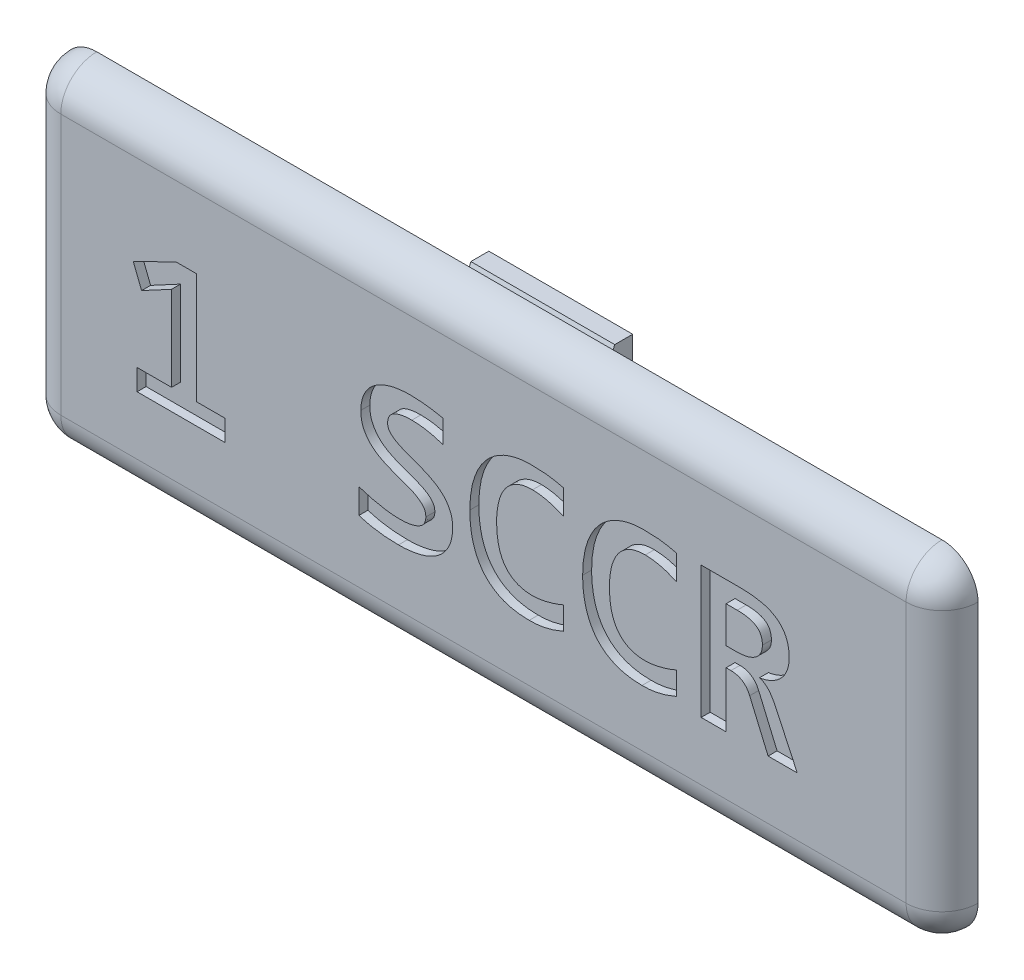
from build123d import *

# Parameters (mm, degrees)
BOSS_EXTRUDE1_DEPTH = 2
SKETCH3_W           = 47.5
SKETCH3_H           = 15
BOSS_EXTRUDE2_DEPTH = 1
SKETCH4_W           = 9.5
SKETCH4_H           = 5
CUT_EXTRUDE1_DEPTH  = 1
SKETCH5_W           = 8
SKETCH5_H           = 8.5
CUT_EXTRUDE2_DEPTH  = 1
SKETCH6_W           = 4
SKETCH6_H           = 1.75
BOSS_EXTRUDE3_DEPTH = 1.75
BOSS_EXTRUDE4_DEPTH = 4
FILLET1_R           = 2
CUT_EXTRUDE3_DEPTH  = 0.5


with BuildPart() as part:
    # Sketch1 → Boss-Extrude1 (new body)
    with BuildSketch(Plane.XY):
        with BuildLine():
            Line((25.5, -7.25), (25.5, 7.25))
            ThreePointArc((25.5, 7.25), (24.914213562, 8.664213562), (23.5, 9.25))
            Line((23.5, 9.25), (-23.5, 9.25))
            ThreePointArc((-23.5, 9.25), (-24.914213562, 8.664213562), (-25.5, 7.25))
            Line((-25.5, 7.25), (-25.5, -7.25))
            ThreePointArc((-25.5, -7.25), (-24.914213562, -8.664213562), (-23.5, -9.25))
            Line((-23.5, -9.25), (23.5, -9.25))
            ThreePointArc((23.5, -9.25), (24.914213562, -8.664213562), (25.5, -7.25))
        make_face()
    extrude(amount=BOSS_EXTRUDE1_DEPTH)

    # Sketch3 → Boss-Extrude2 (add)
    with BuildSketch(Plane(origin=(0, 0, 0), x_dir=(-1, 0, 0), z_dir=(0, 0, -1))):
        Rectangle(SKETCH3_W, SKETCH3_H)
    extrude(amount=BOSS_EXTRUDE2_DEPTH)

    # Sketch4 → Cut-Extrude1 (cut)
    with BuildSketch(Plane(origin=(0, 0, -1), x_dir=(-1, 0, 0), z_dir=(0, 0, -1))):
        with Locations((-13.5, -5)):
            Rectangle(SKETCH4_W, SKETCH4_H)
    extrude(amount=-CUT_EXTRUDE1_DEPTH, mode=Mode.SUBTRACT)

    # Sketch5 → Cut-Extrude2 (cut)
    with BuildSketch(Plane(origin=(0, 0, -1), x_dir=(-1, 0, 0), z_dir=(0, 0, -1))):
        with Locations((-17, 3.5)):
            Rectangle(SKETCH5_W, SKETCH5_H)
    extrude(amount=-CUT_EXTRUDE2_DEPTH, mode=Mode.SUBTRACT)

    # Sketch6 → Boss-Extrude3 (add)
    with BuildSketch(Plane(origin=(0, 0, 0), x_dir=(-1, 0, 0), z_dir=(0, 0, -1))):
        with Locations((-13.5, -8.375)):
            Rectangle(SKETCH6_W, SKETCH6_H)
    extrude(amount=BOSS_EXTRUDE3_DEPTH)

    # Sketch8 → Boss-Extrude4 (add, symmetric)
    with BuildSketch(Plane(origin=(0, 0, 0), x_dir=(0, 0, -1), z_dir=(1, 0, 0))):
        Polygon((2.3, 6.05), (2.3, 8.25), (1.3, 8.25), (1, 7.5), (1, 5.25), align=None)
    boss_extrude4 = extrude(amount=BOSS_EXTRUDE4_DEPTH, both=True)

    # Mirror1: Boss-Extrude4 across plane
    add(boss_extrude4.mirror(Plane.ZX))

    # Fillet1
    fillet1_edges = [part.edges().sort_by_distance(p)[0] for p in [
        (-24.914213562, 8.664213562, 2),
        (0, 9.25, 2),
        (24.914213562, 8.664213562, 2),
        (25.5, 0, 2),
        (24.914213562, -8.664213562, 2),
        (0, -9.25, 2),
        (-24.914213562, -8.664213562, 2),
        (-25.5, 0, 2),
    ]]
    fillet(fillet1_edges, radius=FILLET1_R - 0.0001)  # a hair under: the kernel refuses the full size

    # Sketch9 → Cut-Extrude3 (cut)
    # profile 1 of 5: a face of its own
    with BuildSketch(Plane.XY.offset(2)):
        Polygon((-19.255769503, -4), (-19.255769503, -2.830494933), (-17.342033939, -2.830494933), (-17.342033939, 1.892378511), (-19.008246414, 0.996976195), (-19.468406788, 2.166481261), (-17.089527163, 3.335986328), (-15.959891587, 3.335986328), (-15.959891587, -2.830494933), (-14.365111951, -2.830494933), (-14.365111951, -4), align=None)
    # profile 2 of 5: a face of its own
    with BuildSketch(Plane.XY.offset(2)):
        with BuildLine():
            add(Edge.make_bspline(
                [(-1.713193501, -1.772292195), (-1.715233027, -1.86883922), (-1.719193694, -2.056329111), (-1.76456463, -2.327452066), (-1.832762425, -2.580211484), (-1.931851129, -2.812595013), (-2.055559882, -3.024552799), (-2.201396602, -3.217804638), (-2.369960467, -3.391303509), (-2.561057485, -3.544437546), (-2.771652397, -3.679455981), (-3.001453676, -3.795948339), (-3.251311274, -3.891826562), (-3.517936509, -3.971067083), (-3.800658831, -4.032295381), (-4.097155575, -4.074474411), (-4.406621897, -4.102272544), (-4.617512739, -4.104952633), (-4.725001294, -4.106318642)],
                knots=[0, 0, 0, 0, 1.073681499, 2.085040185, 3.051149047, 3.981944283, 4.887978953, 5.776845786, 6.670466122, 7.573455289, 8.49677068, 9.450589821, 10.436166866, 11.471749255, 12.544173733, 13.653021529, 14.803772988, 16, 16, 16, 16], degree=3))
            add(Edge.make_bspline(
                [(-4.725001294, -4.106318642), (-4.915614486, -4.102798045), (-5.291554785, -4.095854484), (-5.847807662, -4.040981544), (-6.39253871, -3.942410694), (-6.745288718, -3.83926823), (-6.92280698, -3.787362715)],
                knots=[0, 0, 0, 0, 1.025764599, 2.023082686, 3.005134181, 4, 4, 4, 4], degree=3))
            Line((-6.92280698, -3.787362715), (-6.92280698, -2.405220363))
            add(Edge.make_bspline(
                [(-6.92280698, -2.405220363), (-6.833194946, -2.433752405), (-6.651247326, -2.491683655), (-6.373987719, -2.573947282), (-6.089179773, -2.643700599), (-5.802658794, -2.707893455), (-5.515483022, -2.758875756), (-5.230310999, -2.799365289), (-4.949748281, -2.825427735), (-4.764369425, -2.828828163), (-4.673503201, -2.830494933)],
                knots=[0, 0, 0, 0, 0.982138956, 1.994127776, 3.019379675, 4.043652595, 5.060010385, 6.064286964, 7.051181246, 8, 8, 8, 8], degree=3))
            add(Edge.make_bspline(
                [(-4.673503201, -2.830494933), (-4.60925134, -2.830041177), (-4.486167432, -2.82917194), (-4.308685604, -2.817522363), (-4.146813448, -2.797713359), (-3.99841215, -2.771659209), (-3.864938101, -2.736600061), (-3.74354992, -2.697026889), (-3.63584851, -2.650592558), (-3.539569694, -2.599216546), (-3.457062112, -2.541104792), (-3.385200234, -2.479147037), (-3.326842052, -2.41049185), (-3.264639214, -2.31293006), (-3.212644507, -2.175714647), (-3.205354658, -2.060183021), (-3.201654495, -2.001541768)],
                knots=[0, 0, 0, 0, 1.428616996, 2.73672639, 3.952495327, 5.053878092, 6.0842745, 7.018828766, 7.890331589, 8.689308687, 9.440856164, 10.130100935, 10.793906804, 11.436117796, 12.698631087, 14, 14, 14, 14], degree=3))
            add(Edge.make_bspline(
                [(-3.201654495, -2.001541768), (-3.203654865, -1.958771597), (-3.207546134, -1.875571834), (-3.235337867, -1.755432625), (-3.286848579, -1.647416226), (-3.356182013, -1.550251705), (-3.441638553, -1.462276945), (-3.536744971, -1.376740422), (-3.648540437, -1.301439577), (-3.813457809, -1.201559554), (-4.046762146, -1.089822564), (-4.353324012, -0.977026591), (-4.677987751, -0.863142475), (-5.011825054, -0.742734921), (-5.344079319, -0.604190817), (-5.618909124, -0.480251865), (-5.830295789, -0.36590432), (-5.979520777, -0.26961421), (-6.120127413, -0.163700793), (-6.253528902, -0.050172024), (-6.375319735, 0.076312692), (-6.483114552, 0.215194346), (-6.580596385, 0.364229564), (-6.665806043, 0.5253021), (-6.735490144, 0.701900771), (-6.782405313, 0.895267416), (-6.810964062, 1.105210511), (-6.814600779, 1.25049351), (-6.816488338, 1.325899495)],
                knots=[0, 0, 0, 0, 0.628577789, 1.222756944, 1.798018064, 2.376093337, 2.969100815, 3.597678604, 4.252424917, 4.946124793, 6.431204757, 8.043936516, 9.745465074, 11.488681512, 13.25853968, 15.035457213, 15.916880054, 16.788288763, 17.642849837, 18.502665518, 19.360321436, 20.218324825, 21.082903639, 21.974822425, 22.892221362, 23.865363472, 24.892063288, 26, 26, 26, 26], degree=3))
            add(Edge.make_bspline(
                [(-6.816488338, 1.325899495), (-6.814677983, 1.396899448), (-6.81109741, 1.537325268), (-6.779301757, 1.744578619), (-6.732185213, 1.94709667), (-6.661993259, 2.142380693), (-6.572896903, 2.330295573), (-6.45836874, 2.505213834), (-6.32339806, 2.669490324), (-6.163880377, 2.819446715), (-5.981962022, 2.956357854), (-5.775612689, 3.077128365), (-5.547240693, 3.186132933), (-5.293180526, 3.27637227), (-5.014319785, 3.352603328), (-4.707642475, 3.403362452), (-4.374177679, 3.438208093), (-4.142563975, 3.44090476), (-4.022301516, 3.442304971)],
                knots=[0, 0, 0, 0, 0.86106195, 1.703033948, 2.539139973, 3.380790137, 4.216301896, 5.056905248, 5.911254958, 6.790607679, 7.707171391, 8.668295362, 9.687250551, 10.773449095, 11.935660323, 13.190638171, 14.54127474, 16, 16, 16, 16], degree=3))
            add(Edge.make_bspline(
                [(-4.022301516, 3.442304971), (-3.947526177, 3.441212585), (-3.794545853, 3.438977711), (-3.562482704, 3.424728832), (-3.3269951, 3.405528791), (-3.093355447, 3.37840904), (-2.865021743, 3.347628146), (-2.645999032, 3.310337834), (-2.439472029, 3.273976103), (-2.307811674, 3.244011532), (-2.244786713, 3.229667686)],
                knots=[0, 0, 0, 0, 1.000632186, 2.047159369, 3.110551158, 4.162103459, 5.194366354, 6.193323381, 7.135155576, 8, 8, 8, 8], degree=3))
            Line((-2.244786713, 3.229667686), (-2.244786713, 1.953843976))
            add(Edge.make_bspline(
                [(-2.244786713, 1.953843976), (-2.307699226, 1.976638887), (-2.437996654, 2.02384918), (-2.64237069, 2.083612661), (-2.858228133, 2.139088539), (-3.082399583, 2.184375354), (-3.311096004, 2.223247434), (-3.539547555, 2.250317419), (-3.76279106, 2.270577425), (-3.909294908, 2.27207115), (-3.980770797, 2.272799904)],
                knots=[0, 0, 0, 0, 0.905300762, 1.874958649, 2.879989676, 3.920459461, 4.968805495, 6.018141936, 7.033096622, 8, 8, 8, 8], degree=3))
            add(Edge.make_bspline(
                [(-3.980770797, 2.272799904), (-4.039494833, 2.272389091), (-4.152639542, 2.27159757), (-4.31501932, 2.259293716), (-4.463951016, 2.242252446), (-4.598430671, 2.214824371), (-4.72093559, 2.184100685), (-4.830644173, 2.145519451), (-4.930089415, 2.10263298), (-5.017746418, 2.052694949), (-5.095715439, 1.998747048), (-5.159385349, 1.934970283), (-5.21504554, 1.868264099), (-5.26993136, 1.768647923), (-5.318691272, 1.631342363), (-5.324855855, 1.515217838), (-5.328027344, 1.45547534)],
                knots=[0, 0, 0, 0, 1.388230333, 2.674729552, 3.848979118, 4.930101904, 5.917823404, 6.833012122, 7.677256906, 8.474713018, 9.216010271, 9.910495862, 10.599653, 11.262301414, 12.591538262, 14, 14, 14, 14], degree=3))
            add(Edge.make_bspline(
                [(-5.328027344, 1.45547534), (-5.326140309, 1.418174266), (-5.322476867, 1.345758875), (-5.292841221, 1.241254428), (-5.244216499, 1.14496574), (-5.174135585, 1.058742341), (-5.0895785, 0.979081521), (-4.993264051, 0.902275726), (-4.882776874, 0.83164487), (-4.716935667, 0.738595927), (-4.483141394, 0.633682813), (-4.179215829, 0.515750977), (-3.852427598, 0.403089781), (-3.51888139, 0.274869482), (-3.183158369, 0.138552943), (-2.911012928, 0.005444147), (-2.699270575, -0.110275923), (-2.550153937, -0.208418222), (-2.40942641, -0.315837742), (-2.277071103, -0.431003405), (-2.154457389, -0.556327431), (-2.044300439, -0.692798283), (-1.948190949, -0.841233473), (-1.86402334, -1.000219255), (-1.795019176, -1.171685328), (-1.746923831, -1.358660404), (-1.718929065, -1.560463106), (-1.715145096, -1.700214789), (-1.713193501, -1.772292195)],
                knots=[0, 0, 0, 0, 0.557156268, 1.081649532, 1.611348813, 2.159818371, 2.733894156, 3.347031838, 3.999468898, 4.692937397, 6.19005387, 7.82657883, 9.568786128, 11.359307707, 13.171290529, 14.986394118, 15.88741221, 16.778746798, 17.653416553, 18.53387112, 19.400741367, 20.27258301, 21.152453011, 22.041629961, 22.959843454, 23.910073311, 24.922113205, 26, 26, 26, 26], degree=3))
        make_face()
    # profile 3 of 5: a face of its own
    with BuildSketch(Plane.XY.offset(2)):
        with BuildLine():
            add(Edge.make_bspline(
                [(4.45328776, -3.681044073), (4.372217974, -3.715651713), (4.213161544, -3.78355084), (3.972748056, -3.869639406), (3.736722457, -3.943199485), (3.502831276, -4.003376747), (3.268503599, -4.051305953), (3.030754934, -4.081278545), (2.788575749, -4.102804536), (2.625431912, -4.105137879), (2.542874654, -4.106318642)],
                knots=[0, 0, 0, 0, 1.072602722, 2.104413604, 3.106297595, 4.08050826, 5.042709706, 6.014913564, 6.995467464, 8, 8, 8, 8], degree=3))
            add(Edge.make_bspline(
                [(2.542874654, -4.106318642), (2.413728184, -4.103492024), (2.162983726, -4.098004001), (1.79763062, -4.05421812), (1.455509278, -3.981881344), (1.135407943, -3.880896975), (0.839698664, -3.74894936), (0.566976326, -3.588758587), (0.317755098, -3.400288826), (0.093762938, -3.182517542), (-0.105393212, -2.936959921), (-0.276462504, -2.661403863), (-0.424786984, -2.360128288), (-0.545975999, -2.030430302), (-0.640277326, -1.673279527), (-0.707095612, -1.288682645), (-0.749812595, -0.876744797), (-0.754110337, -0.592930873), (-0.756325719, -0.446631622)],
                knots=[0, 0, 0, 0, 1.102605573, 2.140764961, 3.136846793, 4.08496906, 5.001529512, 5.896051515, 6.780328523, 7.66316301, 8.557497515, 9.473264751, 10.427030373, 11.420482266, 12.467702166, 13.577100782, 14.751053738, 16, 16, 16, 16], degree=3))
            add(Edge.make_bspline(
                [(-0.756325719, -0.446631622), (-0.753667796, -0.296438203), (-0.748486532, -0.003656335), (-0.702160165, 0.422129627), (-0.631194587, 0.823413824), (-0.525440088, 1.197531333), (-0.395354931, 1.546322967), (-0.23652584, 1.866121809), (-0.055632105, 2.159862228), (0.153437343, 2.423544911), (0.386576277, 2.659138786), (0.644713649, 2.864478875), (0.924700837, 3.042084351), (1.22970337, 3.18668041), (1.555545965, 3.300804906), (1.901435568, 3.384664843), (2.267413645, 3.432723431), (2.517816106, 3.439062962), (2.645870839, 3.442304971)],
                knots=[0, 0, 0, 0, 1.232307787, 2.402218284, 3.511138658, 4.573037126, 5.588482404, 6.562047137, 7.499038646, 8.414657469, 9.317692522, 10.213424542, 11.116219401, 12.033010505, 12.977368732, 13.94518829, 14.949178196, 16, 16, 16, 16], degree=3))
            add(Edge.make_bspline(
                [(2.645870839, 3.442304971), (2.727839596, 3.442379303), (2.886840555, 3.442523492), (3.119358272, 3.432355728), (3.342375572, 3.423315248), (3.560391528, 3.399418422), (3.778025589, 3.373138858), (3.997853534, 3.33205503), (4.224403065, 3.289945185), (4.375983186, 3.250026087), (4.45328776, 3.229667686)],
                knots=[0, 0, 0, 0, 1.077376558, 2.089868288, 3.059369192, 4.010411707, 4.972009834, 5.940198088, 6.949518525, 8, 8, 8, 8], degree=3))
            Line((4.45328776, 3.229667686), (4.45328776, 1.847525334))
            add(Edge.make_bspline(
                [(4.45328776, 1.847525334), (4.373946173, 1.883908699), (4.218583533, 1.955152746), (3.983416207, 2.04394639), (3.755143128, 2.120277488), (3.53189074, 2.175420359), (3.318020652, 2.21935258), (3.112736965, 2.248995054), (2.917569989, 2.268267408), (2.7904383, 2.271322067), (2.728932278, 2.272799904)],
                knots=[0, 0, 0, 0, 1.170030163, 2.291093263, 3.368831198, 4.395296508, 5.372370687, 6.295361994, 7.175300008, 8, 8, 8, 8], degree=3))
            add(Edge.make_bspline(
                [(2.728932278, 2.272799904), (2.643533004, 2.27071407), (2.478614608, 2.266686021), (2.240437809, 2.231648306), (2.021545776, 2.172374666), (1.822203654, 2.08841263), (1.640760132, 1.984052988), (1.475143446, 1.861337692), (1.328315735, 1.716704966), (1.198336054, 1.554716953), (1.084692277, 1.375038531), (0.987167081, 1.178986948), (0.905265096, 0.966562601), (0.841699666, 0.738750149), (0.791830967, 0.497822889), (0.757970043, 0.244643479), (0.735263199, -0.019834089), (0.733191739, -0.200166262), (0.732135275, -0.292137345)],
                knots=[0, 0, 0, 0, 1.109729706, 2.143049175, 3.121026665, 4.050204485, 4.946654748, 5.836403406, 6.722153568, 7.618170183, 8.530804457, 9.480502004, 10.460411604, 11.48580219, 12.551706219, 13.656287425, 14.804684813, 16, 16, 16, 16], degree=3))
            add(Edge.make_bspline(
                [(0.732135275, -0.292137345), (0.732967869, -0.389108251), (0.734592834, -0.578365433), (0.760041659, -0.853722278), (0.792682067, -1.114433872), (0.844523514, -1.35809311), (0.909855882, -1.585438087), (0.99385864, -1.794112454), (1.09109911, -1.986543156), (1.206539657, -2.160422771), (1.337983831, -2.316818706), (1.488654779, -2.451462953), (1.655337671, -2.5676376), (1.838994972, -2.664747876), (2.041365823, -2.739263874), (2.261119877, -2.791527194), (2.498028958, -2.826230809), (2.662352053, -2.829042844), (2.747205795, -2.830494933)],
                knots=[0, 0, 0, 0, 1.256876421, 2.453033611, 3.583260076, 4.661975506, 5.679853963, 6.646528144, 7.574590913, 8.470745685, 9.346915849, 10.216322401, 11.082788599, 11.975686973, 12.902638023, 13.870910894, 14.900573425, 16, 16, 16, 16], degree=3))
            add(Edge.make_bspline(
                [(2.747205795, -2.830494933), (2.812631955, -2.828899674), (2.948967401, -2.825575464), (3.159104265, -2.796657186), (3.377766428, -2.755402575), (3.601336587, -2.704040956), (3.824130367, -2.641187625), (4.043316784, -2.568293444), (4.253261032, -2.489921555), (4.38813096, -2.432810969), (4.45328776, -2.405220363)],
                knots=[0, 0, 0, 0, 0.887372101, 1.849111607, 2.873273884, 3.906654629, 4.960374994, 6.012916101, 7.040022999, 8, 8, 8, 8], degree=3))
            Line((4.45328776, -2.405220363), (4.45328776, -3.681044073))
        make_face()
    # profile 4 of 5: a face of its own
    with BuildSketch(Plane.XY.offset(2)):
        with BuildLine():
            add(Edge.make_bspline(
                [(10.726087664, -3.681044073), (10.645017878, -3.715651713), (10.485961448, -3.78355084), (10.24554796, -3.869639406), (10.009522361, -3.943199485), (9.77563118, -4.003376747), (9.541303503, -4.051305953), (9.303554838, -4.081278545), (9.061375653, -4.102804536), (8.898231816, -4.105137879), (8.815674558, -4.106318642)],
                knots=[0, 0, 0, 0, 1.072602722, 2.104413604, 3.106297595, 4.08050826, 5.042709706, 6.014913564, 6.995467464, 8, 8, 8, 8], degree=3))
            add(Edge.make_bspline(
                [(8.815674558, -4.106318642), (8.686528088, -4.103492024), (8.435783629, -4.098004001), (8.070430524, -4.05421812), (7.728309182, -3.981881344), (7.408207847, -3.880896975), (7.112498568, -3.74894936), (6.83977623, -3.588758587), (6.590555002, -3.400288826), (6.366562841, -3.182517542), (6.167406691, -2.936959921), (5.996337399, -2.661403863), (5.84801292, -2.360128288), (5.726823905, -2.030430302), (5.632522578, -1.673279527), (5.565704292, -1.288682645), (5.522987308, -0.876744797), (5.518689567, -0.592930873), (5.516474185, -0.446631622)],
                knots=[0, 0, 0, 0, 1.102605573, 2.140764961, 3.136846793, 4.08496906, 5.001529512, 5.896051515, 6.780328523, 7.66316301, 8.557497515, 9.473264751, 10.427030373, 11.420482266, 12.467702166, 13.577100782, 14.751053738, 16, 16, 16, 16], degree=3))
            add(Edge.make_bspline(
                [(5.516474185, -0.446631622), (5.519132108, -0.296438203), (5.524313372, -0.003656335), (5.570639739, 0.422129627), (5.641605317, 0.823413824), (5.747359816, 1.197531333), (5.877444973, 1.546322967), (6.036274064, 1.866121809), (6.217167799, 2.159862228), (6.426237247, 2.423544911), (6.659376181, 2.659138786), (6.917513553, 2.864478875), (7.19750074, 3.042084351), (7.502503274, 3.18668041), (7.828345869, 3.300804906), (8.174235472, 3.384664843), (8.540213549, 3.432723431), (8.79061601, 3.439062962), (8.918670743, 3.442304971)],
                knots=[0, 0, 0, 0, 1.232307787, 2.402218284, 3.511138658, 4.573037126, 5.588482404, 6.562047137, 7.499038646, 8.414657469, 9.317692522, 10.213424542, 11.116219401, 12.033010505, 12.977368732, 13.94518829, 14.949178196, 16, 16, 16, 16], degree=3))
            add(Edge.make_bspline(
                [(8.918670743, 3.442304971), (9.0006395, 3.442379303), (9.159640459, 3.442523492), (9.392158176, 3.432355728), (9.615175476, 3.423315248), (9.833191432, 3.399418422), (10.050825493, 3.373138858), (10.270653438, 3.33205503), (10.497202969, 3.289945185), (10.64878309, 3.250026087), (10.726087664, 3.229667686)],
                knots=[0, 0, 0, 0, 1.077376558, 2.089868288, 3.059369192, 4.010411707, 4.972009834, 5.940198088, 6.949518525, 8, 8, 8, 8], degree=3))
            Line((10.726087664, 3.229667686), (10.726087664, 1.847525334))
            add(Edge.make_bspline(
                [(10.726087664, 1.847525334), (10.646746077, 1.883908699), (10.491383437, 1.955152746), (10.256216111, 2.04394639), (10.027943032, 2.120277488), (9.804690643, 2.175420359), (9.590820555, 2.21935258), (9.385536869, 2.248995054), (9.190369893, 2.268267408), (9.063238204, 2.271322067), (9.001732182, 2.272799904)],
                knots=[0, 0, 0, 0, 1.170030163, 2.291093263, 3.368831198, 4.395296508, 5.372370687, 6.295361994, 7.175300008, 8, 8, 8, 8], degree=3))
            add(Edge.make_bspline(
                [(9.001732182, 2.272799904), (8.916332908, 2.27071407), (8.751414511, 2.266686021), (8.513237712, 2.231648306), (8.29434568, 2.172374666), (8.095003558, 2.08841263), (7.913560035, 1.984052988), (7.74794335, 1.861337692), (7.601115638, 1.716704966), (7.471135958, 1.554716953), (7.35749218, 1.375038531), (7.259966985, 1.178986948), (7.178065, 0.966562601), (7.11449957, 0.738750149), (7.064630871, 0.497822889), (7.030769947, 0.244643479), (7.008063103, -0.019834089), (7.005991643, -0.200166262), (7.004935179, -0.292137345)],
                knots=[0, 0, 0, 0, 1.109729706, 2.143049175, 3.121026665, 4.050204485, 4.946654748, 5.836403406, 6.722153568, 7.618170183, 8.530804457, 9.480502004, 10.460411604, 11.48580219, 12.551706219, 13.656287425, 14.804684813, 16, 16, 16, 16], degree=3))
            add(Edge.make_bspline(
                [(7.004935179, -0.292137345), (7.005767772, -0.389108251), (7.007392737, -0.578365433), (7.032841562, -0.853722278), (7.065481971, -1.114433872), (7.117323418, -1.35809311), (7.182655786, -1.585438087), (7.266658544, -1.794112454), (7.363899014, -1.986543156), (7.479339561, -2.160422771), (7.610783735, -2.316818706), (7.761454683, -2.451462953), (7.928137575, -2.5676376), (8.111794876, -2.664747876), (8.314165727, -2.739263874), (8.53391978, -2.791527194), (8.770828861, -2.826230809), (8.935151957, -2.829042844), (9.020005699, -2.830494933)],
                knots=[0, 0, 0, 0, 1.256876421, 2.453033611, 3.583260076, 4.661975506, 5.679853963, 6.646528144, 7.574590913, 8.470745685, 9.346915849, 10.216322401, 11.082788599, 11.975686973, 12.902638023, 13.870910894, 14.900573425, 16, 16, 16, 16], degree=3))
            add(Edge.make_bspline(
                [(9.020005699, -2.830494933), (9.085431859, -2.828899674), (9.221767305, -2.825575464), (9.431904169, -2.796657186), (9.650566332, -2.755402575), (9.874136491, -2.704040956), (10.096930271, -2.641187625), (10.316116688, -2.568293444), (10.526060936, -2.489921555), (10.660930864, -2.432810969), (10.726087664, -2.405220363)],
                knots=[0, 0, 0, 0, 0.887372101, 1.849111607, 2.873273884, 3.906654629, 4.960374994, 6.012916101, 7.040022999, 8, 8, 8, 8], degree=3))
            Line((10.726087664, -2.405220363), (10.726087664, -3.681044073))
        make_face()
    # profile 5 of 5: a face of its own
    with BuildSketch(Plane.XY.offset(2)):
        with BuildLine():
            Line((15.829382501, -4), (14.804404339, -1.606169316))
            add(Edge.make_bspline(
                [(14.804404339, -1.606169316), (14.779460599, -1.551560995), (14.73099014, -1.445446581), (14.632886218, -1.304923819), (14.520963779, -1.184858891), (14.392757541, -1.087875148), (14.252406254, -1.010820377), (14.099099547, -0.955020147), (13.933499481, -0.924044981), (13.81941853, -0.91922244), (13.76115266, -0.916759369)],
                knots=[0, 0, 0, 0, 1.07937985, 2.097441539, 3.071055259, 4.024539089, 4.97969058, 5.945096662, 6.95047571, 8, 8, 8, 8], degree=3))
            Line((13.76115266, -0.916759369), (13.490372368, -0.916759369))
            Line((13.490372368, -0.916759369), (13.490372368, -4))
            Line((13.490372368, -4), (12.108230016, -4))
            Line((12.108230016, -4), (12.108230016, 3.335986328))
            Line((12.108230016, 3.335986328), (14.284439728, 3.335986328))
            add(Edge.make_bspline(
                [(14.284439728, 3.335986328), (14.385239514, 3.334558203), (14.582024792, 3.33177016), (14.869980409, 3.314507122), (15.142571932, 3.280355035), (15.400931983, 3.23678202), (15.643439528, 3.177654578), (15.868859081, 3.102221807), (16.074566864, 3.006751373), (16.261789897, 2.895060751), (16.431256532, 2.767544518), (16.578817671, 2.619467952), (16.705857208, 2.453509044), (16.81364176, 2.269510715), (16.896644607, 2.064631188), (16.95620659, 1.839219269), (16.993302183, 1.592367778), (16.996980303, 1.420173449), (16.998887568, 1.330883181)],
                knots=[0, 0, 0, 0, 1.254438722, 2.448964256, 3.587437174, 4.671603447, 5.707801299, 6.690588177, 7.624750448, 8.524079809, 9.399245701, 10.256818247, 11.116851234, 11.993805779, 12.902354155, 13.858471343, 14.889524007, 16, 16, 16, 16], degree=3))
            add(Edge.make_bspline(
                [(16.998887568, 1.330883181), (16.997231778, 1.266027698), (16.994008135, 1.139761161), (16.970695717, 0.955512005), (16.93094301, 0.782490816), (16.875946919, 0.620678219), (16.807311099, 0.469971709), (16.726109827, 0.329818696), (16.630380446, 0.200963764), (16.522568296, 0.083327798), (16.403745256, -0.022866842), (16.276691913, -0.120584195), (16.139125063, -0.206491695), (15.992374519, -0.28066425), (15.839567405, -0.346219442), (15.679689722, -0.39844254), (15.51453445, -0.442650533), (15.401513756, -0.462940622), (15.344303695, -0.473211283)],
                knots=[0, 0, 0, 0, 1.155349972, 2.249340124, 3.302347646, 4.313193118, 5.288908417, 6.248327119, 7.193487508, 8.143168254, 9.086215168, 10.029416886, 10.995709606, 11.970826185, 12.956664107, 13.955010984, 14.964844911, 16, 16, 16, 16], degree=3))
            add(Edge.make_bspline(
                [(15.344303695, -0.473211283), (15.388663804, -0.484841723), (15.478919204, -0.5085051), (15.60591461, -0.576550257), (15.728056084, -0.665064066), (15.844231011, -0.779239962), (15.955945376, -0.920394957), (16.068387043, -1.087983483), (16.179339873, -1.285151384), (16.248281151, -1.428002511), (16.284559189, -1.503173132)],
                knots=[0, 0, 0, 0, 0.75991202, 1.546122521, 2.376404305, 3.261596413, 4.243343524, 5.3639781, 6.612881775, 8, 8, 8, 8], degree=3))
            Line((16.284559189, -1.503173132), (17.44908057, -4))
            Line((17.44908057, -4), (15.829382501, -4))
        make_face()
        with BuildLine():
            add(Edge.make_bspline(
                [(15.510426574, 1.18137259), (15.509631991, 1.223508343), (15.508088357, 1.305365345), (15.491568818, 1.423597864), (15.462832905, 1.532551577), (15.425475948, 1.632271234), (15.376062634, 1.723132937), (15.314652668, 1.803901015), (15.242708245, 1.876239609), (15.159258847, 1.938225642), (15.066359281, 1.993062483), (14.961867848, 2.039395757), (14.847043984, 2.079627461), (14.72052339, 2.110126311), (14.58354943, 2.135262873), (14.435419027, 2.152973554), (14.276337715, 2.165182299), (14.166517367, 2.166039962), (14.110010705, 2.166481261)],
                knots=[0, 0, 0, 0, 1.03221539, 2.00528173, 2.91708139, 3.789130794, 4.609038712, 5.442315575, 6.267597059, 7.100873922, 7.98300273, 8.906244241, 9.897686097, 10.9608414, 12.092146654, 13.309174969, 14.615470257, 16, 16, 16, 16], degree=3))
            Line((14.110010705, 2.166481261), (13.490372368, 2.166481261))
            Line((13.490372368, 2.166481261), (13.490372368, 0.146427055))
            Line((13.490372368, 0.146427055), (14.063496299, 0.146427055))
            add(Edge.make_bspline(
                [(14.063496299, 0.146427055), (14.167812384, 0.149398433), (14.367684411, 0.15509166), (14.609596621, 0.196674424), (14.786164293, 0.244407579), (14.904701134, 0.292562688), (15.015047858, 0.34469923), (15.115189573, 0.406651435), (15.205671928, 0.476024524), (15.283724779, 0.555191143), (15.353055308, 0.640002535), (15.40989794, 0.734005413), (15.454378741, 0.835799617), (15.48863851, 0.944131172), (15.506327137, 1.060632159), (15.509033549, 1.140343917), (15.510426574, 1.18137259)],
                knots=[0, 0, 0, 0, 2.184691281, 4.185918933, 5.126368008, 6.012027286, 6.863184627, 7.681184451, 8.47504028, 9.246354907, 10.005704987, 10.765941227, 11.540044168, 12.329221459, 13.140028664, 14, 14, 14, 14], degree=3))
        make_face(mode=Mode.SUBTRACT)
    extrude(amount=-CUT_EXTRUDE3_DEPTH, mode=Mode.SUBTRACT)


solid = part.part
